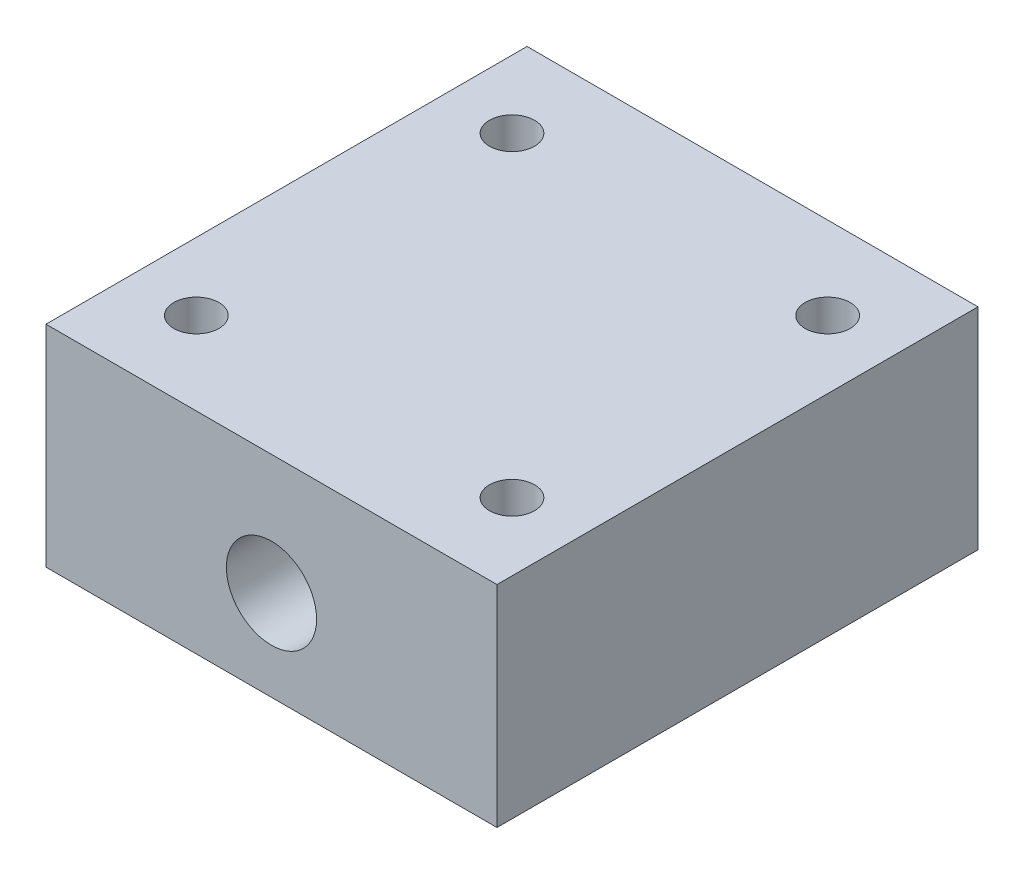
from build123d import *

# Parameters (mm, degrees)
SKETCH1_W                = 30
SKETCH1_H                = 32
BOSS_EXTRUDE1_DEPTH      = 14
CAVITY1_START            = 44.284378121
CAVITY1_OUTLINE_R        = 3
CAVITY1_DEPTH            = 32
M3_CLEARANCE_HOLE1_D     = 3
M3_CLEARANCE_HOLE1_DEPTH = 7
M3_CLEARANCE_HOLE1_TIP   = 0.901290929


# Read off the part's stored shape, not the designer's step: Cavity1
with BuildPart() as part:
    # Sketch1 → Boss-Extrude1 (new body)
    with BuildSketch(Plane(origin=(0, 8, 0), x_dir=(1, 0, 0), z_dir=(0, 1, 0))):
        with Locations((0, -60.284378121)):
            Rectangle(SKETCH1_W, SKETCH1_H)
    extrude(amount=-BOSS_EXTRUDE1_DEPTH)

    # Cavity1 outline → Cavity1 (cut)
    with BuildSketch(Plane.XY.offset(CAVITY1_START)):
        Circle(CAVITY1_OUTLINE_R)
    extrude(amount=CAVITY1_DEPTH, mode=Mode.SUBTRACT)

    # M3 Clearance Hole1
    with Locations(Plane(origin=(0, 8, 0), x_dir=(1, 0, 0), z_dir=(0, 1, 0))):
        with Locations((10.5, -49.784378121), (-10.5, -49.784378121), (-10.5, -70.784378121), (10.5, -70.784378121)):
            Hole(M3_CLEARANCE_HOLE1_D / 2, depth=M3_CLEARANCE_HOLE1_DEPTH)
            with Locations((0, 0, -(M3_CLEARANCE_HOLE1_DEPTH + M3_CLEARANCE_HOLE1_TIP / 2))):  # 118° drill point
                Cone(0, M3_CLEARANCE_HOLE1_D / 2, M3_CLEARANCE_HOLE1_TIP, mode=Mode.SUBTRACT)


solid = part.part
